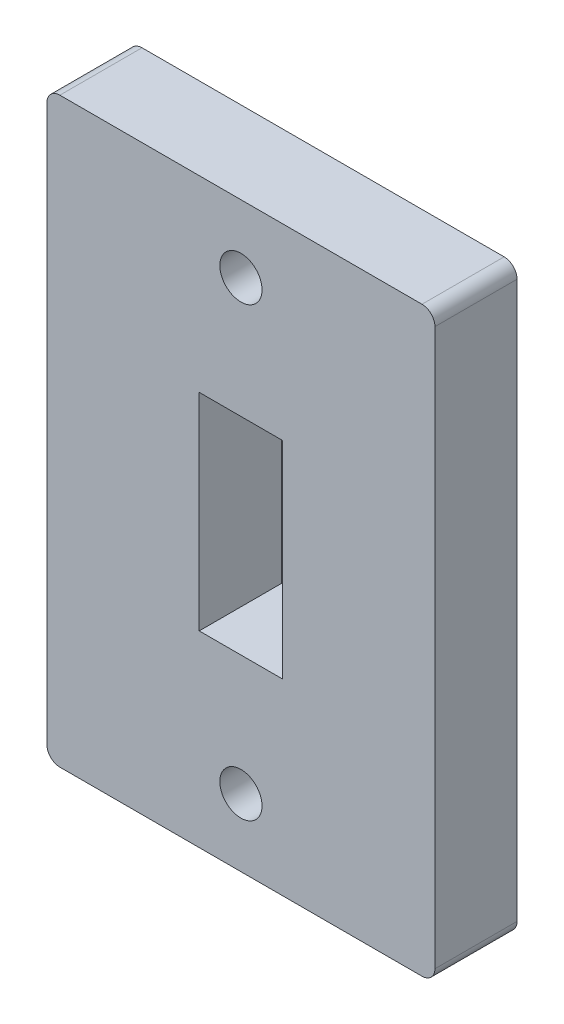
from build123d import *

# Parameters (mm, degrees)
SKETCH1_W                                        = 60
SKETCH1_H                                        = 90
BOSS_EXTRUDE1_DEPTH                              = 12.7
CSK_FOR_1_4_FLAT_HEAD_MACHINE_SCREW1_D           = 6.5278
CSK_FOR_1_4_FLAT_HEAD_MACHINE_SCREW1_CSINK_D     = 12.8778
CSK_FOR_1_4_FLAT_HEAD_MACHINE_SCREW1_CSINK_ANGLE = 82
FILLET1_R                                        = 2


with BuildPart() as part:
    # Sketch1 → Boss-Extrude1 (new body)
    with BuildSketch(Plane.XY):
        with Locations((30, -45)):
            Rectangle(SKETCH1_W, SKETCH1_H)
        Polygon((30, -29.025), (36.45, -29.025), (36.45, -60.975), (30, -60.975), (23.55, -60.975), (23.55, -29.025), align=None, mode=Mode.SUBTRACT)
    extrude(amount=BOSS_EXTRUDE1_DEPTH)

    # CSK for 1/4 Flat Head Machine Screw1 (through all)
    with Locations(Plane(origin=(0, 0, 0), x_dir=(-1, 0, 0), z_dir=(0, 0, -1))):
        with Locations((-30, -10.44), (-30, -79.56)):
            CounterSinkHole(CSK_FOR_1_4_FLAT_HEAD_MACHINE_SCREW1_D / 2, CSK_FOR_1_4_FLAT_HEAD_MACHINE_SCREW1_CSINK_D / 2, counter_sink_angle=CSK_FOR_1_4_FLAT_HEAD_MACHINE_SCREW1_CSINK_ANGLE)

    # Fillet1
    fillet1_edges = [part.edges().sort_by_distance(p)[0] for p in [
        (0, 0, 6.35),
        (60, 0, 6.35),
        (0, -90, 6.35),
        (60, -90, 6.35),
    ]]
    fillet(fillet1_edges, radius=FILLET1_R)


solid = part.part
